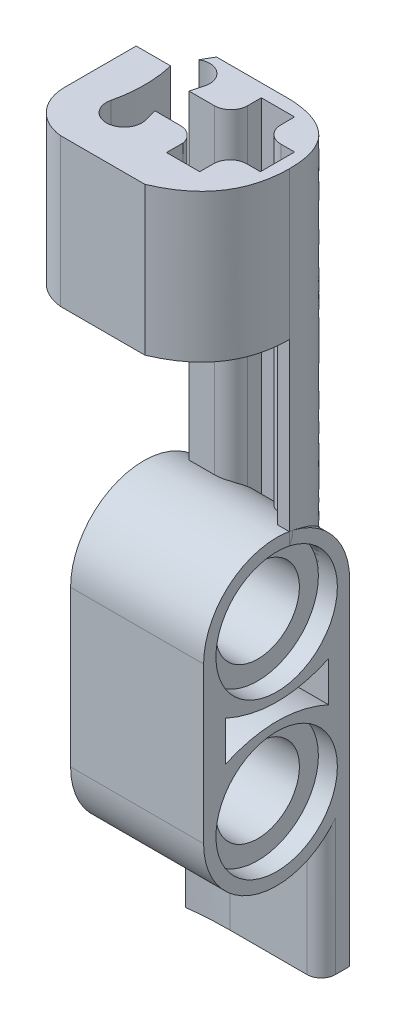
from build123d import *

# Parameters (mm, degrees)
SKETCH4_R                 = 3.2
BOSS_EXTRUDE1_DEPTH       = 7.01
SKETCH4_3_R               = 3.2
SKETCH4_3_R_2             = 2.2
BOSS_EXTRUDE2_DEPTH       = 7.01
SKETCH4_4_R               = 3.2
SKETCH4_4_R_2             = 2.2
BOSS_EXTRUDE3_DEPTH       = 7.01
CUT_EXTRUDE6_DEPTH        = 1
CUT_EXTRUDE6_DEPTH_BACK   = 1
SKETCH4_10_R              = 3.2
SKETCH4_10_R_2            = 2.2
CUT_EXTRUDE7_DEPTH        = 1
CUT_EXTRUDE7_DEPTH_BACK   = 1
SKETCH4_11_R              = 3.2
SKETCH4_11_R_2            = 2.2
BOSS_EXTRUDE7_DEPTH       = 7.8
BOSS_EXTRUDE10_DEPTH      = 20.35
CUT_EXTRUDE8_DEPTH        = 35.787560655
CUT_EXTRUDE8_DEPTH_BACK   = 35.787560655
SKETCH12_R                = 3.2
SKETCH12_R_2              = 2.2
CUT_EXTRUDE10_START       = 4
SKETCH12_4_R              = 3.2
CUT_EXTRUDE10_DEPTH       = 4
BOSS_EXTRUDE14_REACH      = 42.043
BOSS_EXTRUDE14_END_RADIUS = 3.85
BOSS_EXTRUDE15_DEPTH      = 38


with BuildPart() as part:
    # Sketch4 → Boss-Extrude1 (new body)
    with BuildSketch(Plane(origin=(9.58482821, 0, 0), x_dir=(0, 0, -1), z_dir=(1, 0, 0))):
        with BuildLine():
            ThreePointArc((-0.15, -11.7), (3.7, -15.55), (7.55, -11.7))
            Line((7.55, -11.7), (7.55, -3.5))
            ThreePointArc((7.55, -3.5), (3.7, 0.35), (-0.15, -3.5))
            Line((-0.15, -3.5), (-0.15, -11.7))
        make_face()
        with Locations((3.7, -11.7)):
            Circle(SKETCH4_R, mode=Mode.SUBTRACT)
        with BuildLine():
            Line((6.437612841, -6.55), (6.437612841, -7.6))
            Line((6.437612841, -7.6), (6.437612841, -8.125))
            Line((6.437612841, -8.125), (6.437612841, -8.65))
            add(Edge.make_bspline(
                [(6.437612841, -8.65), (3.717003621, -7.429947086), (1, -8.65)],
                knots=[0, 0, 0, 1, 1, 1], degree=2))
            Line((1, -8.65), (1, -7.6))
            Line((1, -7.6), (1, -6.55))
            add(Edge.make_bspline(
                [(6.437612841, -6.55), (3.717003621, -7.770052914), (1, -6.55)],
                knots=[0, 0, 0, 1, 1, 1], degree=2))
        make_face(mode=Mode.SUBTRACT)
        with Locations((3.7, -3.5)):
            Circle(SKETCH4_R, mode=Mode.SUBTRACT)
    extrude(amount=-BOSS_EXTRUDE1_DEPTH)

    # Sketch4<3> → Boss-Extrude2 (add)
    with BuildSketch(Plane(origin=(9.58482821, 0, 0), x_dir=(0, 0, -1), z_dir=(1, 0, 0))):
        with Locations((3.7, -3.5)):
            Circle(SKETCH4_3_R)
        with Locations((3.7, -3.5)):
            Circle(SKETCH4_3_R_2, mode=Mode.SUBTRACT)
    extrude(amount=-BOSS_EXTRUDE2_DEPTH)

    # Sketch4<4> → Boss-Extrude3 (add)
    with BuildSketch(Plane(origin=(9.58482821, 0, 0), x_dir=(0, 0, -1), z_dir=(1, 0, 0))):
        with Locations((3.7, -11.7)):
            Circle(SKETCH4_4_R)
        with Locations((3.7, -11.7)):
            Circle(SKETCH4_4_R_2, mode=Mode.SUBTRACT)
    extrude(amount=-BOSS_EXTRUDE3_DEPTH)

    # Sketch4<10> → Cut-Extrude6 (cut, two sides: drawn at the far end of the back side and taken through both)
    with BuildSketch(Plane(origin=(9.58482821, 0, 0), x_dir=(0, 0, -1), z_dir=(1, 0, 0)).offset(-CUT_EXTRUDE6_DEPTH_BACK)):
        with Locations((3.7, -11.7)):
            Circle(SKETCH4_10_R)
        with Locations((3.7, -11.7)):
            Circle(SKETCH4_10_R_2, mode=Mode.SUBTRACT)
    extrude(amount=CUT_EXTRUDE6_DEPTH + CUT_EXTRUDE6_DEPTH_BACK, mode=Mode.SUBTRACT)

    # Sketch4<11> → Cut-Extrude7 (cut, two sides: drawn at the far end of the back side and taken through both)
    with BuildSketch(Plane(origin=(9.58482821, 0, 0), x_dir=(0, 0, -1), z_dir=(1, 0, 0)).offset(-CUT_EXTRUDE7_DEPTH_BACK)):
        with Locations((3.7, -3.5)):
            Circle(SKETCH4_11_R)
        with Locations((3.7, -3.5)):
            Circle(SKETCH4_11_R_2, mode=Mode.SUBTRACT)
    extrude(amount=CUT_EXTRUDE7_DEPTH + CUT_EXTRUDE7_DEPTH_BACK, mode=Mode.SUBTRACT)


with BuildPart() as body_2:
    # Sketch1 → Boss-Extrude7 (new body)
    with BuildSketch(Plane(origin=(0, 0, 0), x_dir=(1, 0, 0), z_dir=(0, 1, 0))):
        with BuildLine():
            Line((3.59469637, -2.072497286), (3.398257221, -2.8))
            Line((3.398257221, -2.8), (4.733187591, -2.8))
            ThreePointArc((4.733187591, -2.8), (5.272835448, -2.614259361), (5.583849365, -2.13573064))
            ThreePointArc((5.583849365, -2.13573064), (5.603437785, -2.030260467), (5.61, -1.923187591))
            Line((5.61, -1.923187591), (5.61, -1.2))
            Line((5.61, -1.2), (7.36, -1.2))
            Line((7.36, -1.2), (7.36, -1.923187591))
            ThreePointArc((7.36, -1.923187591), (7.616812409, -2.543187591), (8.236812409, -2.8))
            Line((8.236812409, -2.8), (8.96, -2.8))
            Line((8.96, -2.8), (8.96, -4.6))
            Line((8.96, -4.6), (8.236812409, -4.6))
            ThreePointArc((8.236812409, -4.6), (7.616812409, -4.856812409), (7.36, -5.476812409))
            Line((7.36, -5.476812409), (7.36, -6.2))
            Line((7.36, -6.2), (5.61, -6.2))
            Line((5.61, -6.2), (5.61, -5.321612701))
            ThreePointArc((5.61, -5.321612701), (5.300973839, -4.8036001), (4.733187591, -4.6))
            Line((4.733187591, -4.6), (3.398257221, -4.6))
            Line((3.398257221, -4.6), (3.59469637, -5.321612701))
            ThreePointArc((3.59469637, -5.321612701), (2.650201437, -6.429674305), (1.763543504, -5.27481115))
            ThreePointArc((1.763543504, -5.27481115), (1.949996233, -3.707128316), (1.766858128, -2.139054809))
            ThreePointArc((1.766858128, -2.139054809), (1.76646436, -2.137393083), (1.766073636, -2.13573064))
            Line((1.766073636, -2.13573064), (-0.051864294, -2.13573064))
            Line((-0.051864294, -2.13573064), (-0.051864294, -5.92))
            ThreePointArc((-0.051864294, -5.92), (0.551221604, -7.47586198), (2.045368773, -8.21879087))
            Line((2.045368773, -8.21879087), (6.485, -8.21879087))
            add(Edge.make_bspline(
                [(6.485, -8.21879087), (9.5712117, -6.934911374), (9.58482821, -3.7)],
                knots=[0, 0, 0, 1, 1, 1], degree=2))
            add(Edge.make_bspline(
                [(9.58482821, -3.7), (9.628287772, -0.669812126), (6.467585098, -0.52)],
                knots=[0, 0, 0, 1, 1, 1], degree=2))
            Line((6.467585098, -0.52), (2.569996233, -0.52))
            Line((2.569996233, -0.52), (2.569996233, -0.9964218))
            ThreePointArc((2.569996233, -0.9964218), (3.349499839, -1.280060786), (3.59469637, -2.072497286))
        make_face()
    extrude(amount=-BOSS_EXTRUDE7_DEPTH)

    # Sketch1<9> → Boss-Extrude10 (add)
    with BuildSketch(Plane(origin=(0, 0, 0), x_dir=(1, 0, 0), z_dir=(0, 1, 0))):
        with BuildLine():
            Line((3.59469637, -2.072497286), (3.398257221, -2.8))
            Line((3.398257221, -2.8), (4.733187591, -2.8))
            ThreePointArc((4.733187591, -2.8), (5.272835448, -2.614259361), (5.583849365, -2.13573064))
            ThreePointArc((5.583849365, -2.13573064), (5.603437785, -2.030260467), (5.61, -1.923187591))
            Line((5.61, -1.923187591), (5.61, -1.2))
            Line((5.61, -1.2), (7.36, -1.2))
            Line((7.36, -1.2), (7.36, -1.923187591))
            ThreePointArc((7.36, -1.923187591), (7.616812409, -2.543187591), (8.236812409, -2.8))
            Line((8.236812409, -2.8), (8.96, -2.8))
            Line((8.96, -2.8), (8.96, -3.7))
            Line((8.96, -3.7), (9.58482821, -3.7))
            add(Edge.make_bspline(
                [(9.58482821, -3.7), (9.628287772, -0.669812126), (6.467585098, -0.52)],
                knots=[0, 0, 0, 1, 1, 1], degree=2))
            Line((6.467585098, -0.52), (2.569996233, -0.52))
            Line((2.569996233, -0.52), (2.569996233, -0.9964218))
            ThreePointArc((2.569996233, -0.9964218), (3.349499839, -1.280060786), (3.59469637, -2.072497286))
        make_face()
    extrude(amount=-BOSS_EXTRUDE10_DEPTH)

    # Sketch12 → Cut-Extrude8 (cut, two sides: drawn at the far end of the back side and taken through both)
    # profile 1 of 2: a face of its own
    with BuildSketch(Plane(origin=(9.58482821, 0, 0), x_dir=(0, 0, -1), z_dir=(1, 0, 0)).offset(-CUT_EXTRUDE8_DEPTH_BACK)):
        with Locations((-4.368790873, -20.349999996)):
            Circle(SKETCH12_R)
        with Locations((-4.368790873, -20.349999996)):
            Circle(SKETCH12_R_2, mode=Mode.SUBTRACT)
    # profile 2 of 2: a face of its own
    with BuildSketch(Plane(origin=(9.58482821, 0, 0), x_dir=(0, 0, -1), z_dir=(1, 0, 0)).offset(-CUT_EXTRUDE8_DEPTH_BACK)):
        with Locations((-4.368790873, -20.349999996)):
            Circle(SKETCH12_R)
    extrude(amount=CUT_EXTRUDE8_DEPTH + CUT_EXTRUDE8_DEPTH_BACK, mode=Mode.SUBTRACT)

    # Sketch12<4> → Cut-Extrude10 (cut)
    with BuildSketch(Plane(origin=(9.58482821, 0, 0), x_dir=(0, 0, -1), z_dir=(1, 0, 0)).offset(CUT_EXTRUDE10_START)):
        with BuildLine():
            ThreePointArc((-2.54662978, -23.741493613), (-1.064413458, -22.325750461), (-0.518790873, -20.349999996))
            ThreePointArc((-0.518790873, -20.349999996), (-4.368790873, -16.499999996), (-8.218790873, -20.349999996))
            ThreePointArc((-8.218790873, -20.349999996), (-7.686598281, -22.303113922), (-6.237152428, -23.716262776))
            add(Edge.make_bspline(
                [(-6.237152428, -23.716262776), (-4.392721558, -24.290891537), (-2.54662978, -23.741493613)],
                knots=[0.15302777, 0.15302777, 0.15302777, 0.831737351, 0.831737351, 0.831737351], degree=2))
        make_face()
        with Locations((-4.368790873, -20.349999996)):
            Circle(SKETCH12_4_R, mode=Mode.SUBTRACT)
    extrude(amount=-CUT_EXTRUDE10_DEPTH, mode=Mode.SUBTRACT)

    # Sketch20 → Boss-Extrude15 (add)
    with BuildSketch(Plane(origin=(0, 0, 0), x_dir=(1, 0, 0), z_dir=(0, 1, 0))):
        with BuildLine():
            Line((2.569996233, -0.9964218), (2.569996233, -0.52))
            Line((2.569996233, -0.52), (2.227471679, -1.104508185))
            ThreePointArc((2.227471679, -1.104508185), (2.393481354, -1.033819556), (2.569996233, -0.9964218))
        make_face()
    extrude(amount=-BOSS_EXTRUDE15_DEPTH)


with BuildPart() as part_1:
    # Move Face5: read off the stored shape, not the designer's step
    # Move Face5: moved
    add(part.part.moved(Location((0, -16.85, 8.0687909))))

    # Boss-Extrude14: up to this cylinder (the profile starts outside it)
    boss_extrude14_end = Plane(origin=(6.013975, -28.549999996, 4.368790873), z_dir=(1, 0, 0)) * Cylinder(BOSS_EXTRUDE14_END_RADIUS, 92.786, mode=Mode.PRIVATE)
    # Sketch2<17> → Boss-Extrude14 (add, up to the surface)
    with BuildSketch(Plane(origin=(0, -38, 0), x_dir=(-1, 0, 0), z_dir=(0, -1, 0)), mode=Mode.PRIVATE) as boss_extrude14_sk1:
        with BuildLine():
            Line((-2.57482821, -2.156184836), (-2.57482821, -0.518790873))
            Line((-2.57482821, -0.518790873), (-8.83482821, -0.518790873))
            Line((-8.83482821, -0.518790873), (-9.58482821, -0.518790873))
            Line((-9.58482821, -0.518790873), (-9.58482821, -1.268790873))
            ThreePointArc((-9.58482821, -1.268790873), (-9.365158296, -1.799120959), (-8.83482821, -2.018790873))
            Line((-8.83482821, -2.018790873), (-4.78482821, -2.018790873))
            add(Edge.make_bspline(
                [(-4.78482821, -2.018790873), (-4.707310794, -2.018437294), (-4.62993665, -2.018790873)],
                knots=[0, 0, 0, 0.026241233, 0.026241233, 0.026241233], degree=2))
            add(Edge.make_bspline(
                [(-4.62993665, -2.018790873), (-3.589427607, -2.023545726), (-2.57482821, -2.156184836)],
                knots=[0.026241233, 0.026241233, 0.026241233, 0.379127073, 0.379127073, 0.379127073], degree=2))
        make_face()
    boss_extrude14_tool1 = extrude(boss_extrude14_sk1.sketch, amount=-BOSS_EXTRUDE14_REACH, mode=Mode.PRIVATE) - boss_extrude14_end
    add(boss_extrude14_tool1.solids().sort_by_distance((6.013975, -38, 1.269386))[0])

    # Cut-Sweep1: sweep along a curve in space
    with BuildLine() as cut_sweep1_path:
        Line((1.766073636, 0, 2.13573064), (2.429429954, -38, 2.17586803))
    # Sketch21 → Cut-Sweep1 (sweep, cut)
    with BuildSketch(Plane(origin=(0, 0, 0), x_dir=(1, 0, 0), z_dir=(0, 1, 0))):
        with BuildLine():
            Line((2.227471679, -1.104508185), (1.741589664, -1.933651709))
            ThreePointArc((1.741589664, -1.933651709), (1.869507543, -1.451675851), (2.227471679, -1.104508185))
        make_face()
    sweep(path=cut_sweep1_path.line, mode=Mode.SUBTRACT)


solid = Compound([body_2.part, part_1.part])
